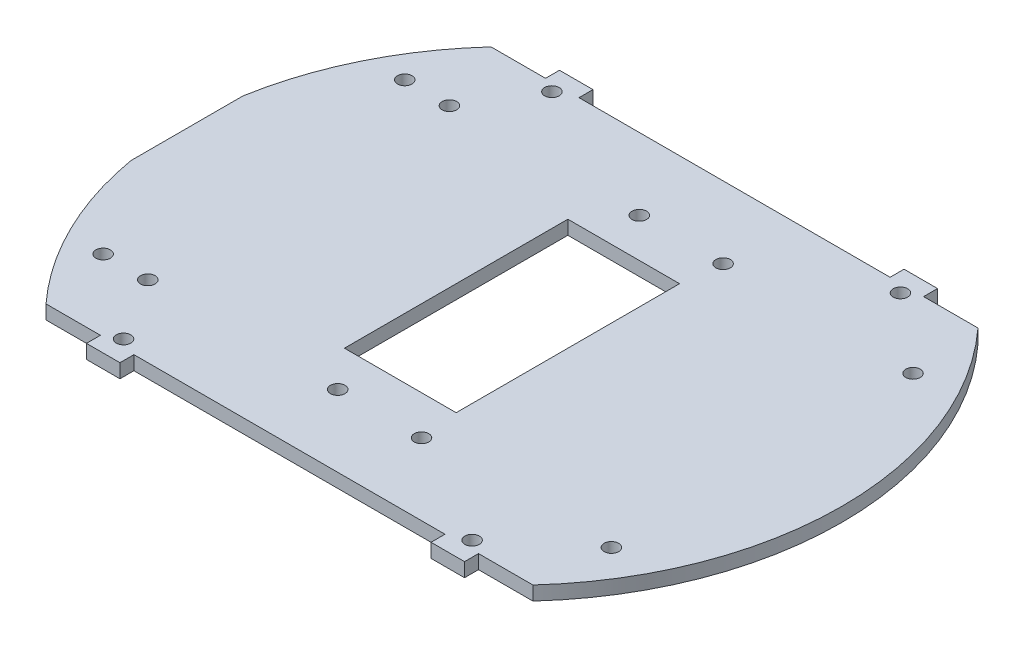
from build123d import *

# Parameters (mm, degrees)
SKETCH1_R           = 1.651
SKETCH1_W           = 25.4
SKETCH1_H           = 50.8
BOSS_EXTRUDE1_DEPTH = 3.175


with BuildPart() as part:
    # Sketch1 → Boss-Extrude1 (new body)
    with BuildSketch(Plane(origin=(0, 0, 0), x_dir=(1, 0, 0), z_dir=(0, 1, 0))):
        with BuildLine():
            Line((-73.916912814, 12.7), (-73.916912814, -12.7))
            ThreePointArc((-73.916912814, -12.7), (-67.357563081, -32.984218889), (-55.35602635, -50.603461806))
            Line((-55.35602635, -50.603461806), (-42.984152136, -50.603461806))
            Line((-42.984152136, -50.603461806), (-42.984152136, -53.778461806))
            Line((-42.984152136, -53.778461806), (-35.364152136, -53.778461806))
            Line((-35.364152136, -53.778461806), (-35.364152136, -50.603461806))
            Line((-35.364152136, -50.603461806), (35.364152136, -50.603461806))
            Line((35.364152136, -50.603461806), (35.364152136, -53.778461806))
            Line((35.364152136, -53.778461806), (42.984152136, -53.778461806))
            Line((42.984152136, -53.778461806), (42.984152136, -50.603461806))
            Line((42.984152136, -50.603461806), (55.35602635, -50.603461806))
            ThreePointArc((55.35602635, -50.603461806), (75, 0), (55.35602635, 50.603461806))
            Line((55.35602635, 50.603461806), (42.984152136, 50.603461806))
            Line((42.984152136, 50.603461806), (42.984152136, 53.778461806))
            Line((42.984152136, 53.778461806), (35.364152136, 53.778461806))
            Line((35.364152136, 53.778461806), (35.364152136, 50.603461806))
            Line((35.364152136, 50.603461806), (-35.364152136, 50.603461806))
            Line((-35.364152136, 50.603461806), (-35.364152136, 53.778461806))
            Line((-35.364152136, 53.778461806), (-42.984152136, 53.778461806))
            Line((-42.984152136, 53.778461806), (-42.984152136, 50.603461806))
            Line((-42.984152136, 50.603461806), (-55.35602635, 50.603461806))
            ThreePointArc((-55.35602635, 50.603461806), (-67.357563081, 32.984218889), (-73.916912814, 12.7))
        make_face()
        with Locations((13.713087186, 34.29)):
            Circle(SKETCH1_R, mode=Mode.SUBTRACT)
        with Locations((-58.676912814, -34.29)):
            Circle(SKETCH1_R, mode=Mode.SUBTRACT)
        with Locations((-58.676912814, 34.29)):
            Circle(SKETCH1_R, mode=Mode.SUBTRACT)
        with Locations((-39.626912814, 48.698461806)):
            Circle(SKETCH1_R, mode=Mode.SUBTRACT)
        with Locations((39.626912814, 48.698461806)):
            Circle(SKETCH1_R, mode=Mode.SUBTRACT)
        with Locations((-39.626912814, -48.698461806)):
            Circle(SKETCH1_R, mode=Mode.SUBTRACT)
        with Locations((39.626912814, -48.698461806)):
            Circle(SKETCH1_R, mode=Mode.SUBTRACT)
        with Locations((56.893087186, 34.29)):
            Circle(SKETCH1_R, mode=Mode.SUBTRACT)
        with Locations((-48.516912814, 34.29)):
            Circle(SKETCH1_R, mode=Mode.SUBTRACT)
        with Locations((-5.336912814, 34.29)):
            Circle(SKETCH1_R, mode=Mode.SUBTRACT)
        with Locations((-5.336912814, -34.29)):
            Circle(SKETCH1_R, mode=Mode.SUBTRACT)
        with Locations((-48.516912814, -34.29)):
            Circle(SKETCH1_R, mode=Mode.SUBTRACT)
        with Locations((13.713087186, -34.29)):
            Circle(SKETCH1_R, mode=Mode.SUBTRACT)
        with Locations((56.893087186, -34.29)):
            Circle(SKETCH1_R, mode=Mode.SUBTRACT)
        Rectangle(SKETCH1_W, SKETCH1_H, mode=Mode.SUBTRACT)
    extrude(amount=BOSS_EXTRUDE1_DEPTH)


solid = part.part
